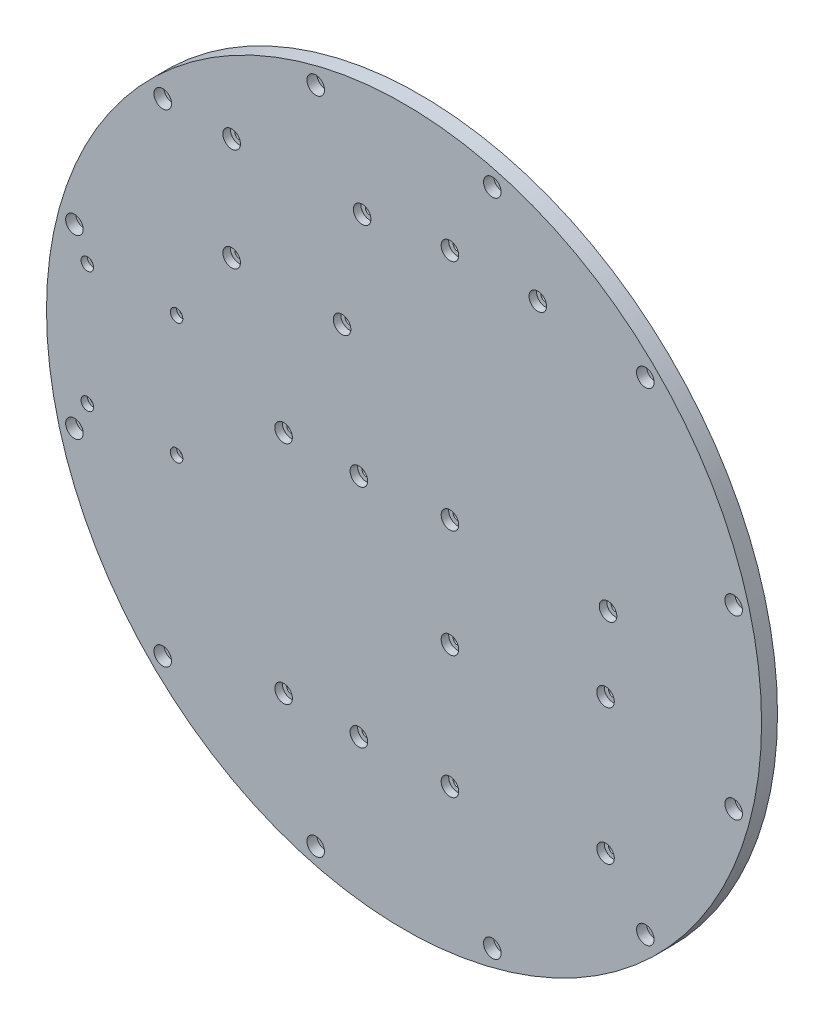
from build123d import *

# Parameters (mm, degrees)
ESQUISSE1_R              = 142.5
ESQUISSE1_R_2            = 1.75
BOSS_EXTRU_1_DEPTH       = 6.35
ESQUISSE2_R              = 3.5
ENL_V_MAT_EXTRU_1_DEPTH  = 4
ENL_V_MAT_EXTRU_2_REACH  = 203.625
ESQUISSE3_R              = 1.25
ESQUISSE4_R              = 2.5
ENL_V_MAT_EXTRU_3_DEPTH  = 2.5
ENL_V_MAT_EXTRU_4_REACH  = 203.625
ESQUISSE5_R              = 1.75
ESQUISSE6_R              = 3.5
ENL_V_MAT_EXTRU_5_DEPTH  = 3
ENL_V_MAT_EXTRU_6_REACH  = 203.625
ESQUISSE7_R              = 1.75
ESQUISSE8_R              = 3.5
ENL_V_MAT_EXTRU_7_DEPTH  = 3
ENL_V_MAT_EXTRU_8_REACH  = 203.625
ESQUISSE9_R              = 1.75
ESQUISSE10_R             = 3.5
ENL_V_MAT_EXTRU_9_DEPTH  = 3
ENL_V_MAT_EXTRU_10_REACH = 203.625
ESQUISSE11_R             = 1.75
ESQUISSE12_R             = 3.5
ENL_V_MAT_EXTRU_11_DEPTH = 3


with BuildPart() as part:
    # Esquisse1 → Boss.-Extru.1 (new body)
    with BuildSketch(Plane.XY):
        Circle(ESQUISSE1_R)
        with Locations((-35.199390134, 131.365912375)):
            Circle(ESQUISSE1_R_2, mode=Mode.SUBTRACT)
        with Locations((35.199390134, 131.365912375)):
            Circle(ESQUISSE1_R_2, mode=Mode.SUBTRACT)
        with Locations((96.166522241, 96.166522241)):
            Circle(ESQUISSE1_R_2, mode=Mode.SUBTRACT)
        with Locations((131.365912375, 35.199390134)):
            Circle(ESQUISSE1_R_2, mode=Mode.SUBTRACT)
        with Locations((131.365912375, -35.199390134)):
            Circle(ESQUISSE1_R_2, mode=Mode.SUBTRACT)
        with Locations((96.166522241, -96.166522241)):
            Circle(ESQUISSE1_R_2, mode=Mode.SUBTRACT)
        with Locations((35.199390134, -131.365912375)):
            Circle(ESQUISSE1_R_2, mode=Mode.SUBTRACT)
        with Locations((-35.199390134, -131.365912375)):
            Circle(ESQUISSE1_R_2, mode=Mode.SUBTRACT)
        with Locations((-96.166522241, -96.166522241)):
            Circle(ESQUISSE1_R_2, mode=Mode.SUBTRACT)
        with Locations((-131.365912375, -35.199390134)):
            Circle(ESQUISSE1_R_2, mode=Mode.SUBTRACT)
        with Locations((-131.365912375, 35.199390134)):
            Circle(ESQUISSE1_R_2, mode=Mode.SUBTRACT)
        with Locations((-96.166522241, 96.166522241)):
            Circle(ESQUISSE1_R_2, mode=Mode.SUBTRACT)
    extrude(amount=BOSS_EXTRU_1_DEPTH)

    # Esquisse2 → Enlèv. mat.-Extru.1 (cut)
    with BuildSketch(Plane.XY.offset(6.35)):
        with Locations((35.199390134, 131.365912375)):
            Circle(ESQUISSE2_R)
        with Locations((96.166522241, 96.166522241)):
            Circle(ESQUISSE2_R)
        with Locations((131.365912375, 35.199390134)):
            Circle(ESQUISSE2_R)
        with Locations((131.365912375, -35.199390134)):
            Circle(ESQUISSE2_R)
        with Locations((96.166522241, -96.166522241)):
            Circle(ESQUISSE2_R)
        with Locations((35.199390134, -131.365912375)):
            Circle(ESQUISSE2_R)
        with Locations((-35.199390134, -131.365912375)):
            Circle(ESQUISSE2_R)
        with Locations((-96.166522241, -96.166522241)):
            Circle(ESQUISSE2_R)
        with Locations((-131.365912375, -35.199390134)):
            Circle(ESQUISSE2_R)
        with Locations((-131.365912375, 35.199390134)):
            Circle(ESQUISSE2_R)
        with Locations((-96.166522241, 96.166522241)):
            Circle(ESQUISSE2_R)
        with Locations((-35.199390134, 131.365912375)):
            Circle(ESQUISSE2_R)
    extrude(amount=-ENL_V_MAT_EXTRU_1_DEPTH, mode=Mode.SUBTRACT)

    # Esquisse3 → Enlèv. mat.-Extru.2 (cut, up to next)
    with BuildSketch(Plane.XY.offset(6.35), mode=Mode.PRIVATE) as enl_v_mat_extru_2_sk1:
        with Locations((-126.214076473, -24.13)):
            Circle(ESQUISSE3_R)
    enl_v_mat_extru_2_tool1 = extrude(enl_v_mat_extru_2_sk1.sketch, amount=-ENL_V_MAT_EXTRU_2_REACH, mode=Mode.PRIVATE) & part.part
    # Esquisse3 → Enlèv. mat.-Extru.2 (cut, up to next)
    with BuildSketch(Plane.XY.offset(6.35), mode=Mode.PRIVATE) as enl_v_mat_extru_2_sk2:
        with Locations((-126.214076473, 24.13)):
            Circle(ESQUISSE3_R)
    enl_v_mat_extru_2_tool2 = extrude(enl_v_mat_extru_2_sk2.sketch, amount=-ENL_V_MAT_EXTRU_2_REACH, mode=Mode.PRIVATE) & part.part
    # Esquisse3 → Enlèv. mat.-Extru.2 (cut, up to next)
    with BuildSketch(Plane.XY.offset(6.35), mode=Mode.PRIVATE) as enl_v_mat_extru_2_sk3:
        with Locations((-90.654076473, 24.13)):
            Circle(ESQUISSE3_R)
    enl_v_mat_extru_2_tool3 = extrude(enl_v_mat_extru_2_sk3.sketch, amount=-ENL_V_MAT_EXTRU_2_REACH, mode=Mode.PRIVATE) & part.part
    # Esquisse3 → Enlèv. mat.-Extru.2 (cut, up to next)
    with BuildSketch(Plane.XY.offset(6.35), mode=Mode.PRIVATE) as enl_v_mat_extru_2_sk4:
        with Locations((-90.654076473, -24.13)):
            Circle(ESQUISSE3_R)
    enl_v_mat_extru_2_tool4 = extrude(enl_v_mat_extru_2_sk4.sketch, amount=-ENL_V_MAT_EXTRU_2_REACH, mode=Mode.PRIVATE) & part.part
    add(enl_v_mat_extru_2_tool1.solids().sort_by_distance((-126.214076, -24.13, 6.35))[0], mode=Mode.SUBTRACT)
    add(enl_v_mat_extru_2_tool2.solids().sort_by_distance((-126.214076, 24.13, 6.35))[0], mode=Mode.SUBTRACT)
    add(enl_v_mat_extru_2_tool3.solids().sort_by_distance((-90.654076, 24.13, 6.35))[0], mode=Mode.SUBTRACT)
    add(enl_v_mat_extru_2_tool4.solids().sort_by_distance((-90.654076, -24.13, 6.35))[0], mode=Mode.SUBTRACT)

    # Esquisse4 → Enlèv. mat.-Extru.3 (cut)
    with BuildSketch(Plane.XY.offset(6.35)):
        with Locations((-126.214076473, -24.13)):
            Circle(ESQUISSE4_R)
        with Locations((-126.214076473, 24.13)):
            Circle(ESQUISSE4_R)
        with Locations((-90.654076473, 24.13)):
            Circle(ESQUISSE4_R)
        with Locations((-90.654076473, -24.13)):
            Circle(ESQUISSE4_R)
    extrude(amount=-ENL_V_MAT_EXTRU_3_DEPTH, mode=Mode.SUBTRACT)

    # Esquisse5 → Enlèv. mat.-Extru.4 (cut, up to next)
    with BuildSketch(Plane.XY.offset(6.35), mode=Mode.PRIVATE) as enl_v_mat_extru_4_sk1:
        with Locations((-48, -85)):
            Circle(ESQUISSE5_R)
    enl_v_mat_extru_4_tool1 = extrude(enl_v_mat_extru_4_sk1.sketch, amount=-ENL_V_MAT_EXTRU_4_REACH, mode=Mode.PRIVATE) & part.part
    # Esquisse5 → Enlèv. mat.-Extru.4 (cut, up to next)
    with BuildSketch(Plane.XY.offset(6.35), mode=Mode.PRIVATE) as enl_v_mat_extru_4_sk2:
        with Locations((-48, 5)):
            Circle(ESQUISSE5_R)
    enl_v_mat_extru_4_tool2 = extrude(enl_v_mat_extru_4_sk2.sketch, amount=-ENL_V_MAT_EXTRU_4_REACH, mode=Mode.PRIVATE) & part.part
    # Esquisse5 → Enlèv. mat.-Extru.4 (cut, up to next)
    with BuildSketch(Plane.XY.offset(6.35), mode=Mode.PRIVATE) as enl_v_mat_extru_4_sk3:
        with Locations((-18, 5)):
            Circle(ESQUISSE5_R)
    enl_v_mat_extru_4_tool3 = extrude(enl_v_mat_extru_4_sk3.sketch, amount=-ENL_V_MAT_EXTRU_4_REACH, mode=Mode.PRIVATE) & part.part
    # Esquisse5 → Enlèv. mat.-Extru.4 (cut, up to next)
    with BuildSketch(Plane.XY.offset(6.35), mode=Mode.PRIVATE) as enl_v_mat_extru_4_sk4:
        with Locations((-18, -85)):
            Circle(ESQUISSE5_R)
    enl_v_mat_extru_4_tool4 = extrude(enl_v_mat_extru_4_sk4.sketch, amount=-ENL_V_MAT_EXTRU_4_REACH, mode=Mode.PRIVATE) & part.part
    add(enl_v_mat_extru_4_tool1.solids().sort_by_distance((-48, -85, 6.35))[0], mode=Mode.SUBTRACT)
    add(enl_v_mat_extru_4_tool2.solids().sort_by_distance((-48, 5, 6.35))[0], mode=Mode.SUBTRACT)
    add(enl_v_mat_extru_4_tool3.solids().sort_by_distance((-18, 5, 6.35))[0], mode=Mode.SUBTRACT)
    add(enl_v_mat_extru_4_tool4.solids().sort_by_distance((-18, -85, 6.35))[0], mode=Mode.SUBTRACT)

    # Esquisse6 → Enlèv. mat.-Extru.5 (cut)
    with BuildSketch(Plane.XY.offset(6.35)):
        with Locations((-48, -85)):
            Circle(ESQUISSE6_R)
        with Locations((-18, -85)):
            Circle(ESQUISSE6_R)
        with Locations((-48, 5)):
            Circle(ESQUISSE6_R)
        with Locations((-18, 5)):
            Circle(ESQUISSE6_R)
    extrude(amount=-ENL_V_MAT_EXTRU_5_DEPTH, mode=Mode.SUBTRACT)

    # Esquisse7 → Enlèv. mat.-Extru.6 (cut, up to next)
    with BuildSketch(Plane.XY.offset(6.35), mode=Mode.PRIVATE) as enl_v_mat_extru_6_sk1:
        with Locations((-68.7, 55)):
            Circle(ESQUISSE7_R)
    enl_v_mat_extru_6_tool1 = extrude(enl_v_mat_extru_6_sk1.sketch, amount=-ENL_V_MAT_EXTRU_6_REACH, mode=Mode.PRIVATE) & part.part
    # Esquisse7 → Enlèv. mat.-Extru.6 (cut, up to next)
    with BuildSketch(Plane.XY.offset(6.35), mode=Mode.PRIVATE) as enl_v_mat_extru_6_sk2:
        with Locations((-68.7, 96)):
            Circle(ESQUISSE7_R)
    enl_v_mat_extru_6_tool2 = extrude(enl_v_mat_extru_6_sk2.sketch, amount=-ENL_V_MAT_EXTRU_6_REACH, mode=Mode.PRIVATE) & part.part
    # Esquisse7 → Enlèv. mat.-Extru.6 (cut, up to next)
    with BuildSketch(Plane.XY.offset(6.35), mode=Mode.PRIVATE) as enl_v_mat_extru_6_sk3:
        with Locations((-24.7, 54)):
            Circle(ESQUISSE7_R)
    enl_v_mat_extru_6_tool3 = extrude(enl_v_mat_extru_6_sk3.sketch, amount=-ENL_V_MAT_EXTRU_6_REACH, mode=Mode.PRIVATE) & part.part
    # Esquisse7 → Enlèv. mat.-Extru.6 (cut, up to next)
    with BuildSketch(Plane.XY.offset(6.35), mode=Mode.PRIVATE) as enl_v_mat_extru_6_sk4:
        with Locations((-16.7, 96)):
            Circle(ESQUISSE7_R)
    enl_v_mat_extru_6_tool4 = extrude(enl_v_mat_extru_6_sk4.sketch, amount=-ENL_V_MAT_EXTRU_6_REACH, mode=Mode.PRIVATE) & part.part
    add(enl_v_mat_extru_6_tool1.solids().sort_by_distance((-68.7, 55, 6.35))[0], mode=Mode.SUBTRACT)
    add(enl_v_mat_extru_6_tool2.solids().sort_by_distance((-68.7, 96, 6.35))[0], mode=Mode.SUBTRACT)
    add(enl_v_mat_extru_6_tool3.solids().sort_by_distance((-24.7, 54, 6.35))[0], mode=Mode.SUBTRACT)
    add(enl_v_mat_extru_6_tool4.solids().sort_by_distance((-16.7, 96, 6.35))[0], mode=Mode.SUBTRACT)

    # Esquisse8 → Enlèv. mat.-Extru.7 (cut)
    with BuildSketch(Plane.XY.offset(6.35)):
        with Locations((-68.7, 55)):
            Circle(ESQUISSE8_R)
        with Locations((-68.7, 96)):
            Circle(ESQUISSE8_R)
        with Locations((-24.7, 54)):
            Circle(ESQUISSE8_R)
        with Locations((-16.7, 96)):
            Circle(ESQUISSE8_R)
    extrude(amount=-ENL_V_MAT_EXTRU_7_DEPTH, mode=Mode.SUBTRACT)

    # Esquisse9 → Enlèv. mat.-Extru.8 (cut, up to next)
    with BuildSketch(Plane(origin=(0, 0, 6.35), x_dir=(-1, 0, 0), z_dir=(0, 0, -1)), mode=Mode.PRIVATE) as enl_v_mat_extru_8_sk1:
        with Locations((-18.3, 101)):
            Circle(ESQUISSE9_R)
    enl_v_mat_extru_8_tool1 = extrude(enl_v_mat_extru_8_sk1.sketch, amount=ENL_V_MAT_EXTRU_8_REACH, mode=Mode.PRIVATE) & part.part
    # Esquisse9 → Enlèv. mat.-Extru.8 (cut, up to next)
    with BuildSketch(Plane(origin=(0, 0, 6.35), x_dir=(-1, 0, 0), z_dir=(0, 0, -1)), mode=Mode.PRIVATE) as enl_v_mat_extru_8_sk2:
        with Locations((-18.3, 8)):
            Circle(ESQUISSE9_R)
    enl_v_mat_extru_8_tool2 = extrude(enl_v_mat_extru_8_sk2.sketch, amount=ENL_V_MAT_EXTRU_8_REACH, mode=Mode.PRIVATE) & part.part
    # Esquisse9 → Enlèv. mat.-Extru.8 (cut, up to next)
    with BuildSketch(Plane(origin=(0, 0, 6.35), x_dir=(-1, 0, 0), z_dir=(0, 0, -1)), mode=Mode.PRIVATE) as enl_v_mat_extru_8_sk3:
        with Locations((-53.3, 101)):
            Circle(ESQUISSE9_R)
    enl_v_mat_extru_8_tool3 = extrude(enl_v_mat_extru_8_sk3.sketch, amount=ENL_V_MAT_EXTRU_8_REACH, mode=Mode.PRIVATE) & part.part
    # Esquisse9 → Enlèv. mat.-Extru.8 (cut, up to next)
    with BuildSketch(Plane(origin=(0, 0, 6.35), x_dir=(-1, 0, 0), z_dir=(0, 0, -1)), mode=Mode.PRIVATE) as enl_v_mat_extru_8_sk4:
        with Locations((-81.3, 8)):
            Circle(ESQUISSE9_R)
    enl_v_mat_extru_8_tool4 = extrude(enl_v_mat_extru_8_sk4.sketch, amount=ENL_V_MAT_EXTRU_8_REACH, mode=Mode.PRIVATE) & part.part
    add(enl_v_mat_extru_8_tool1.solids().sort_by_distance((18.3, 101, 6.35))[0], mode=Mode.SUBTRACT)
    add(enl_v_mat_extru_8_tool2.solids().sort_by_distance((18.3, 8, 6.35))[0], mode=Mode.SUBTRACT)
    add(enl_v_mat_extru_8_tool3.solids().sort_by_distance((53.3, 101, 6.35))[0], mode=Mode.SUBTRACT)
    add(enl_v_mat_extru_8_tool4.solids().sort_by_distance((81.3, 8, 6.35))[0], mode=Mode.SUBTRACT)

    # Esquisse10 → Enlèv. mat.-Extru.9 (cut)
    with BuildSketch(Plane.XY.offset(6.35)):
        with Locations((18.3, 8)):
            Circle(ESQUISSE10_R)
        with Locations((18.3, 101)):
            Circle(ESQUISSE10_R)
        with Locations((53.3, 101)):
            Circle(ESQUISSE10_R)
        with Locations((81.3, 8)):
            Circle(ESQUISSE10_R)
    extrude(amount=-ENL_V_MAT_EXTRU_9_DEPTH, mode=Mode.SUBTRACT)

    # Esquisse11 → Enlèv. mat.-Extru.10 (cut, up to next)
    with BuildSketch(Plane(origin=(0, 0, 6.35), x_dir=(-1, 0, 0), z_dir=(0, 0, -1)), mode=Mode.PRIVATE) as enl_v_mat_extru_10_sk1:
        with Locations((-18.3, -35)):
            Circle(ESQUISSE11_R)
    enl_v_mat_extru_10_tool1 = extrude(enl_v_mat_extru_10_sk1.sketch, amount=ENL_V_MAT_EXTRU_10_REACH, mode=Mode.PRIVATE) & part.part
    # Esquisse11 → Enlèv. mat.-Extru.10 (cut, up to next)
    with BuildSketch(Plane(origin=(0, 0, 6.35), x_dir=(-1, 0, 0), z_dir=(0, 0, -1)), mode=Mode.PRIVATE) as enl_v_mat_extru_10_sk2:
        with Locations((-18.3, -84)):
            Circle(ESQUISSE11_R)
    enl_v_mat_extru_10_tool2 = extrude(enl_v_mat_extru_10_sk2.sketch, amount=ENL_V_MAT_EXTRU_10_REACH, mode=Mode.PRIVATE) & part.part
    # Esquisse11 → Enlèv. mat.-Extru.10 (cut, up to next)
    with BuildSketch(Plane(origin=(0, 0, 6.35), x_dir=(-1, 0, 0), z_dir=(0, 0, -1)), mode=Mode.PRIVATE) as enl_v_mat_extru_10_sk3:
        with Locations((-80.3, -22)):
            Circle(ESQUISSE11_R)
    enl_v_mat_extru_10_tool3 = extrude(enl_v_mat_extru_10_sk3.sketch, amount=ENL_V_MAT_EXTRU_10_REACH, mode=Mode.PRIVATE) & part.part
    # Esquisse11 → Enlèv. mat.-Extru.10 (cut, up to next)
    with BuildSketch(Plane(origin=(0, 0, 6.35), x_dir=(-1, 0, 0), z_dir=(0, 0, -1)), mode=Mode.PRIVATE) as enl_v_mat_extru_10_sk4:
        with Locations((-80.3, -76)):
            Circle(ESQUISSE11_R)
    enl_v_mat_extru_10_tool4 = extrude(enl_v_mat_extru_10_sk4.sketch, amount=ENL_V_MAT_EXTRU_10_REACH, mode=Mode.PRIVATE) & part.part
    add(enl_v_mat_extru_10_tool1.solids().sort_by_distance((18.3, -35, 6.35))[0], mode=Mode.SUBTRACT)
    add(enl_v_mat_extru_10_tool2.solids().sort_by_distance((18.3, -84, 6.35))[0], mode=Mode.SUBTRACT)
    add(enl_v_mat_extru_10_tool3.solids().sort_by_distance((80.3, -22, 6.35))[0], mode=Mode.SUBTRACT)
    add(enl_v_mat_extru_10_tool4.solids().sort_by_distance((80.3, -76, 6.35))[0], mode=Mode.SUBTRACT)

    # Esquisse12 → Enlèv. mat.-Extru.11 (cut)
    with BuildSketch(Plane.XY.offset(6.35)):
        with Locations((18.3, -84)):
            Circle(ESQUISSE12_R)
        with Locations((18.3, -35)):
            Circle(ESQUISSE12_R)
        with Locations((80.3, -22)):
            Circle(ESQUISSE12_R)
        with Locations((80.3, -76)):
            Circle(ESQUISSE12_R)
    extrude(amount=-ENL_V_MAT_EXTRU_11_DEPTH, mode=Mode.SUBTRACT)


solid = part.part
